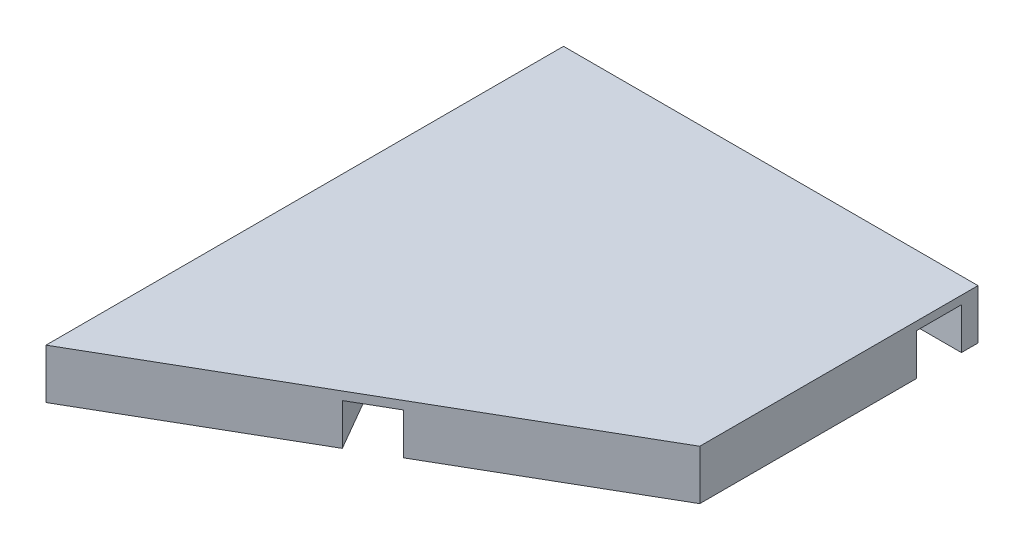
from build123d import *

# Parameters (mm, degrees)
BOSS_EXTRUDE1_DEPTH     = 6
SKETCH2_W               = 100
SKETCH2_H               = 5.4
CUT_EXTRUDE_THIN1_DEPTH = 5
SKETCH3_OUTSIDE_W       = 132.574
SKETCH3_OUTSIDE_H       = 148.044
CUT_EXTRUDE1_DEPTH      = 6
INTERSECT1_START        = -50
INTERSECT1_DEPTH        = 50


# Read off the part's stored shape, not the designer's step: Intersect1
with BuildPart() as part:
    # Sketch1 → Boss-Extrude1 (new body)
    with BuildSketch(Plane(origin=(0, 0, 0), x_dir=(1, 0, 0), z_dir=(0, 1, 0))):
        Polygon((0, 57.735026919), (-50, 28.867513459), (-50, -28.867513459), (0, -57.735026919), (50, -28.867513459), (50, 28.867513459), align=None)
    extrude(amount=BOSS_EXTRUDE1_DEPTH)

    # Sketch2 → Cut-Extrude-Thin1 (cut)
    with BuildSketch(Plane.XZ):
        Polygon((-27.33826859, 41.951270189), (-3.33826859, 0.382050808), (1.33826859, 3.082050808), (-22.66173141, 44.651270189), align=None)
        Rectangle(SKETCH2_W, SKETCH2_H)
        Polygon((22.66173141, 44.651270189), (-1.33826859, 3.082050808), (3.33826859, 0.382050808), (27.33826859, 41.951270189), align=None)
    extrude(amount=-CUT_EXTRUDE_THIN1_DEPTH, mode=Mode.SUBTRACT)

    # Sketch3 outside → Cut-Extrude1 (cut)
    with BuildSketch(Plane.XZ):
        Rectangle(SKETCH3_OUTSIDE_W, SKETCH3_OUTSIDE_H)
        Polygon((-50, 28.867513459), (0, 57.735026919), (50, 28.867513459), (50, -4.7), (-50, -4.7), align=None, mode=Mode.SUBTRACT)
    extrude(amount=-CUT_EXTRUDE1_DEPTH, mode=Mode.SUBTRACT)

    # Intersect1 outline → Intersect1 (cut)
    with BuildSketch(Plane.YZ.offset(INTERSECT1_START)):
        Polygon((0, -2.7), (0, -4.7), (6, -4.7), (6, 59), (0, 59), (0, 2.7), (5, 2.7), (5, -2.7), align=None)
    extrude(amount=INTERSECT1_DEPTH, mode=Mode.SUBTRACT)


solid = part.part
